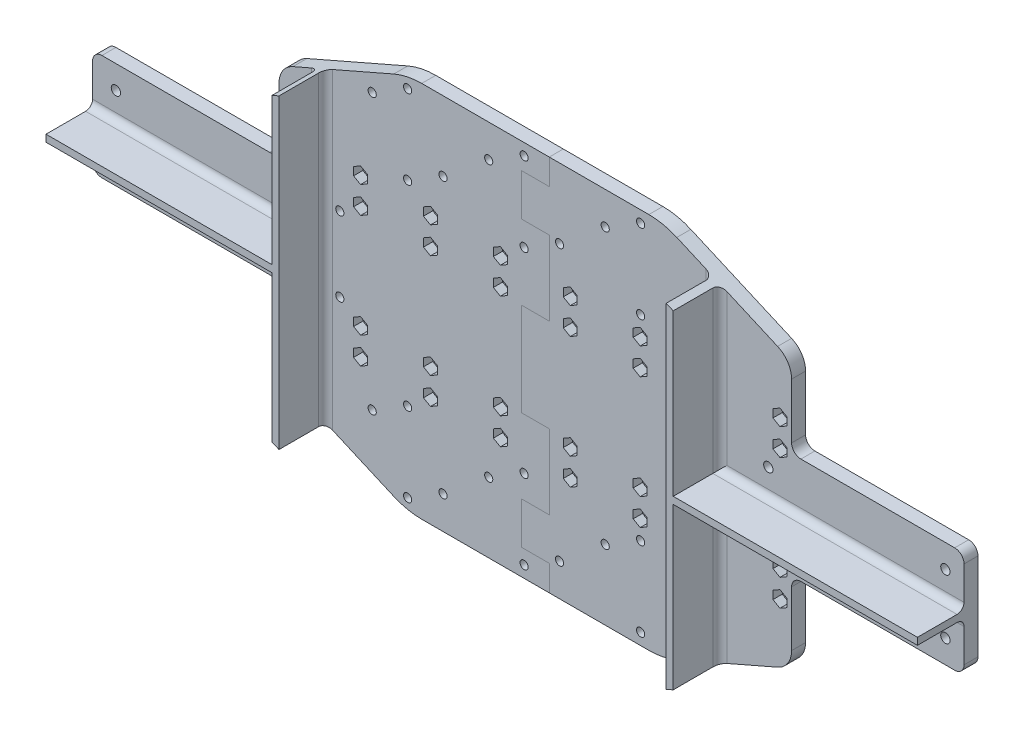
from build123d import *

# Parameters (mm, degrees)
BOSS_EXTRUDE1_DEPTH     = 3
BOSS_EXTRUDE2_DEPTH     = 20
SKETCH4_R               = 1.75
CUT_EXTRUDE1_DEPTH      = 205.768161588
FILLET1_R               = 4
FILLET2_R               = 3
CUT_EXTRUDE2_REACH      = 207.441
SKETCH5_R               = 2
SKETCH6_R               = 1.75
CUT_EXTRUDE3_DEPTH      = 205.768161588
SKETCH8_R               = 1.75
CUT_EXTRUDE5_DEPTH      = 205.768161588
SKETCH9_R               = 1.75
CUT_EXTRUDE6_DEPTH      = 205.768161588
CUT_EXTRUDE7_DEPTH      = 4
SPLIT1_SURFACE_1_BACK   = 409.407
SPLIT1_SURFACE_1_DEPTH  = 818.814
SPLIT1_SURFACE_2_BACK   = 409.407
SPLIT1_SURFACE_2_DEPTH  = 818.814
CUT_EXTRUDE8_DEPTH      = 206.082910063
CUT_EXTRUDE8_DEPTH_BACK = 206.082910063
FILLET3_R               = 4
FILLET4_R               = 4
FILLET5_R               = 10
FILLET6_R               = 10
FILLET7_R               = 30
FILLET8_R               = 30


with BuildPart() as part:
    # Sketch2 → Boss-Extrude1 (new, symmetric)
    with BuildSketch(Plane.XY):
        Polygon((-187, 22.75), (-187, -22.75), (-107, -22.75), (-107, -81), (113, -81), (113, -22.75), (187, -22.75), (187, 22.75), (113, 22.75), (113, 81), (-107, 81), (-107, 22.75), align=None)
    extrude(amount=BOSS_EXTRUDE1_DEPTH, both=True)

    # Sketch3 → Boss-Extrude2 (add)
    with BuildSketch(Plane.XY.offset(3)):
        Polygon((-187, -1.5), (-90, -1.5), (-90, -81), (-87, -81), (-87, 81), (-90, 81), (-90, 1.5), (-187, 1.5), align=None)
        Polygon((82.2, -81), (82.2, -1.5), (187, -1.5), (187, 1.5), (82.2, 1.5), (82.2, 81), (79.2, 81), (79.2, -81), align=None)
    extrude(amount=BOSS_EXTRUDE2_DEPTH)

    # Sketch4 → Cut-Extrude1 (cut, through all)
    with BuildSketch(Plane.XY.offset(3)):
        with Locations((-36.6, -67)):
            Circle(SKETCH4_R)
        with Locations((-67, -51)):
            Circle(SKETCH4_R)
        with Locations((13.4, -67)):
            Circle(SKETCH4_R)
        with Locations((-17, -51)):
            Circle(SKETCH4_R)
        with Locations((63.4, -67)):
            Circle(SKETCH4_R)
        with Locations((33, -51)):
            Circle(SKETCH4_R)
        with Locations((33, 67)):
            Circle(SKETCH4_R)
        with Locations((63.4, 51)):
            Circle(SKETCH4_R)
        with Locations((13.4, 51)):
            Circle(SKETCH4_R)
        with Locations((-17, 67)):
            Circle(SKETCH4_R)
        with Locations((-36.6, 51)):
            Circle(SKETCH4_R)
        with Locations((-67, 67)):
            Circle(SKETCH4_R)
    extrude(amount=-CUT_EXTRUDE1_DEPTH, mode=Mode.SUBTRACT)

    # Fillet1
    fillet1_edges = [part.edges().sort_by_distance(p)[0] for p in [
        (-107, 22.75, 0),
        (-107, -22.75, 0),
        (113, -22.75, 0),
        (113, 22.75, 0),
    ]]
    fillet(fillet1_edges, radius=FILLET1_R)

    # Fillet2
    fillet2_edges = [part.edges().sort_by_distance(p)[0] for p in [
        (-90, 41.25, 3),
        (-138.5, 1.5, 3),
        (-138.5, -1.5, 3),
        (-90, -41.25, 3),
        (82.2, -41.25, 3),
        (134.6, -1.5, 3),
        (134.6, 1.5, 3),
        (82.2, 41.25, 3),
        (-87, 0, 3),
        (79.2, 0, 3),
    ]]
    fillet(fillet2_edges, radius=FILLET2_R)

    # Sketch5 → Cut-Extrude2 (cut, up to next)
    with BuildSketch(Plane(origin=(0, 0, -3), x_dir=(-1, 0, 0), z_dir=(0, 0, -1)), mode=Mode.PRIVATE) as cut_extrude2_sk1:
        with Locations((-103, -12.75)):
            Circle(SKETCH5_R)
    cut_extrude2_tool1 = extrude(cut_extrude2_sk1.sketch, amount=-CUT_EXTRUDE2_REACH, mode=Mode.PRIVATE) & part.part
    # Sketch5 → Cut-Extrude2 (cut, up to next)
    with BuildSketch(Plane(origin=(0, 0, -3), x_dir=(-1, 0, 0), z_dir=(0, 0, -1)), mode=Mode.PRIVATE) as cut_extrude2_sk2:
        with Locations((-103, 12.75)):
            Circle(SKETCH5_R)
    cut_extrude2_tool2 = extrude(cut_extrude2_sk2.sketch, amount=-CUT_EXTRUDE2_REACH, mode=Mode.PRIVATE) & part.part
    # Sketch5 → Cut-Extrude2 (cut, up to next)
    with BuildSketch(Plane(origin=(0, 0, -3), x_dir=(-1, 0, 0), z_dir=(0, 0, -1)), mode=Mode.PRIVATE) as cut_extrude2_sk3:
        with Locations((-179, 12.75)):
            Circle(SKETCH5_R)
    cut_extrude2_tool3 = extrude(cut_extrude2_sk3.sketch, amount=-CUT_EXTRUDE2_REACH, mode=Mode.PRIVATE) & part.part
    # Sketch5 → Cut-Extrude2 (cut, up to next)
    with BuildSketch(Plane(origin=(0, 0, -3), x_dir=(-1, 0, 0), z_dir=(0, 0, -1)), mode=Mode.PRIVATE) as cut_extrude2_sk4:
        with Locations((-179, -12.75)):
            Circle(SKETCH5_R)
    cut_extrude2_tool4 = extrude(cut_extrude2_sk4.sketch, amount=-CUT_EXTRUDE2_REACH, mode=Mode.PRIVATE) & part.part
    # Sketch5 → Cut-Extrude2 (cut, up to next)
    with BuildSketch(Plane(origin=(0, 0, -3), x_dir=(-1, 0, 0), z_dir=(0, 0, -1)), mode=Mode.PRIVATE) as cut_extrude2_sk5:
        with Locations((177, 12.75)):
            Circle(SKETCH5_R)
    cut_extrude2_tool5 = extrude(cut_extrude2_sk5.sketch, amount=-CUT_EXTRUDE2_REACH, mode=Mode.PRIVATE) & part.part
    # Sketch5 → Cut-Extrude2 (cut, up to next)
    with BuildSketch(Plane(origin=(0, 0, -3), x_dir=(-1, 0, 0), z_dir=(0, 0, -1)), mode=Mode.PRIVATE) as cut_extrude2_sk6:
        with Locations((177, -12.75)):
            Circle(SKETCH5_R)
    cut_extrude2_tool6 = extrude(cut_extrude2_sk6.sketch, amount=-CUT_EXTRUDE2_REACH, mode=Mode.PRIVATE) & part.part
    # Sketch5 → Cut-Extrude2 (cut, up to next)
    with BuildSketch(Plane(origin=(0, 0, -3), x_dir=(-1, 0, 0), z_dir=(0, 0, -1)), mode=Mode.PRIVATE) as cut_extrude2_sk7:
        with Locations((101, -12.75)):
            Circle(SKETCH5_R)
    cut_extrude2_tool7 = extrude(cut_extrude2_sk7.sketch, amount=-CUT_EXTRUDE2_REACH, mode=Mode.PRIVATE) & part.part
    # Sketch5 → Cut-Extrude2 (cut, up to next)
    with BuildSketch(Plane(origin=(0, 0, -3), x_dir=(-1, 0, 0), z_dir=(0, 0, -1)), mode=Mode.PRIVATE) as cut_extrude2_sk8:
        with Locations((101, 12.75)):
            Circle(SKETCH5_R)
    cut_extrude2_tool8 = extrude(cut_extrude2_sk8.sketch, amount=-CUT_EXTRUDE2_REACH, mode=Mode.PRIVATE) & part.part
    add(cut_extrude2_tool1.solids().sort_by_distance((103, -12.75, -3))[0], mode=Mode.SUBTRACT)
    add(cut_extrude2_tool2.solids().sort_by_distance((103, 12.75, -3))[0], mode=Mode.SUBTRACT)
    add(cut_extrude2_tool3.solids().sort_by_distance((179, 12.75, -3))[0], mode=Mode.SUBTRACT)
    add(cut_extrude2_tool4.solids().sort_by_distance((179, -12.75, -3))[0], mode=Mode.SUBTRACT)
    add(cut_extrude2_tool5.solids().sort_by_distance((-177, 12.75, -3))[0], mode=Mode.SUBTRACT)
    add(cut_extrude2_tool6.solids().sort_by_distance((-177, -12.75, -3))[0], mode=Mode.SUBTRACT)
    add(cut_extrude2_tool7.solids().sort_by_distance((-101, -12.75, -3))[0], mode=Mode.SUBTRACT)
    add(cut_extrude2_tool8.solids().sort_by_distance((-101, 12.75, -3))[0], mode=Mode.SUBTRACT)

    # Sketch6 → Cut-Extrude3 (cut, through all)
    with BuildSketch(Plane.XY.offset(3)):
        with Locations((-51.8, -76)):
            Circle(SKETCH6_R)
        with Locations((-51.8, -42)):
            Circle(SKETCH6_R)
        with Locations((-1.8, -76)):
            Circle(SKETCH6_R)
        with Locations((-1.8, -42)):
            Circle(SKETCH6_R)
        with Locations((48.2, -76)):
            Circle(SKETCH6_R)
        with Locations((48.2, -42)):
            Circle(SKETCH6_R)
        with Locations((48.2, 42)):
            Circle(SKETCH6_R)
        with Locations((48.2, 76)):
            Circle(SKETCH6_R)
        with Locations((-1.8, 42)):
            Circle(SKETCH6_R)
        with Locations((-1.8, 76)):
            Circle(SKETCH6_R)
        with Locations((-51.8, 42)):
            Circle(SKETCH6_R)
        with Locations((-51.8, 76)):
            Circle(SKETCH6_R)
    extrude(amount=-CUT_EXTRUDE3_DEPTH, mode=Mode.SUBTRACT)

    # Sketch8 → Cut-Extrude5 (cut, through all)
    with BuildSketch(Plane.XY.offset(3)):
        with Locations((-80.9, -16)):
            Circle(SKETCH8_R)
        with Locations((-80.9, 16)):
            Circle(SKETCH8_R)
        with Locations((73.1, 16)):
            Circle(SKETCH8_R)
        with Locations((73.1, -16)):
            Circle(SKETCH8_R)
    extrude(amount=-CUT_EXTRUDE5_DEPTH, mode=Mode.SUBTRACT)

    # Sketch9 → Cut-Extrude6 (cut, through all)
    with BuildSketch(Plane.XY.offset(3)):
        with Locations((-12, -33.75)):
            Circle(SKETCH9_R)
        with Locations((-42, -33.75)):
            Circle(SKETCH9_R)
        with Locations((-72, -33.75)):
            Circle(SKETCH9_R)
        with Locations((-102, -33.75)):
            Circle(SKETCH9_R)
        with Locations((108, -33.75)):
            Circle(SKETCH9_R)
        with Locations((48, -33.75)):
            Circle(SKETCH9_R)
        with Locations((18, -33.75)):
            Circle(SKETCH9_R)
        with Locations((18, -22.25)):
            Circle(SKETCH9_R)
        with Locations((48, -22.25)):
            Circle(SKETCH9_R)
        with Locations((108, -22.25)):
            Circle(SKETCH9_R)
        with Locations((-102, -22.25)):
            Circle(SKETCH9_R)
        with Locations((-72, -22.25)):
            Circle(SKETCH9_R)
        with Locations((-42, -22.25)):
            Circle(SKETCH9_R)
        with Locations((-12, -22.25)):
            Circle(SKETCH9_R)
        with Locations((-12, 22.25)):
            Circle(SKETCH9_R)
        with Locations((-42, 22.25)):
            Circle(SKETCH9_R)
        with Locations((-72, 22.25)):
            Circle(SKETCH9_R)
        with Locations((-102, 22.25)):
            Circle(SKETCH9_R)
        with Locations((108, 22.25)):
            Circle(SKETCH9_R)
        with Locations((48, 22.25)):
            Circle(SKETCH9_R)
        with Locations((18, 22.25)):
            Circle(SKETCH9_R)
        with Locations((18, 33.75)):
            Circle(SKETCH9_R)
        with Locations((48, 33.75)):
            Circle(SKETCH9_R)
        with Locations((108, 33.75)):
            Circle(SKETCH9_R)
        with Locations((-102, 33.75)):
            Circle(SKETCH9_R)
        with Locations((-72, 33.75)):
            Circle(SKETCH9_R)
        with Locations((-42, 33.75)):
            Circle(SKETCH9_R)
        with Locations((-12, 33.75)):
            Circle(SKETCH9_R)
    extrude(amount=-CUT_EXTRUDE6_DEPTH, mode=Mode.SUBTRACT)

    # Sketch10 → Cut-Extrude7 (cut)
    with BuildSketch(Plane.XY.offset(3)):
        Polygon((-99, -35.482050808), (-99, -32.017949192), (-102, -30.285898385), (-105, -32.017949192), (-105, -35.482050808), (-102, -37.214101615), align=None)
        Polygon((-69, -35.482050808), (-69, -32.017949192), (-72, -30.285898385), (-75, -32.017949192), (-75, -35.482050808), (-72, -37.214101615), align=None)
        Polygon((-39, -35.482050808), (-39, -32.017949192), (-42, -30.285898385), (-45, -32.017949192), (-45, -35.482050808), (-42, -37.214101615), align=None)
        Polygon((-9, -35.482050808), (-9, -32.017949192), (-12, -30.285898385), (-15, -32.017949192), (-15, -35.482050808), (-12, -37.214101615), align=None)
        Polygon((51, -32.017949192), (51, -35.482050808), (48, -37.214101615), (45, -35.482050808), (45, -32.017949192), (48, -30.285898385), align=None)
        Polygon((15, -32.017949192), (18, -30.285898385), (21, -32.017949192), (21, -35.482050808), (18, -37.214101615), (15, -35.482050808), align=None)
        Polygon((51, -23.982050808), (51, -20.517949192), (48, -18.785898385), (45, -20.517949192), (45, -23.982050808), (48, -25.714101615), align=None)
        Polygon((105, -23.982050808), (108, -25.714101615), (111, -23.982050808), (111, -20.517949192), (108, -18.785898385), (105, -20.517949192), align=None)
        Polygon((105, -32.017949192), (108, -30.285898385), (111, -32.017949192), (111, -35.482050808), (108, -37.214101615), (105, -35.482050808), align=None)
        Polygon((-45, -20.517949192), (-42, -18.785898385), (-39, -20.517949192), (-39, -23.982050808), (-42, -25.714101615), (-45, -23.982050808), align=None)
        Polygon((-15, -20.517949192), (-12, -18.785898385), (-9, -20.517949192), (-9, -23.982050808), (-12, -25.714101615), (-15, -23.982050808), align=None)
        Polygon((21, -20.517949192), (18, -18.785898385), (15, -20.517949192), (15, -23.982050808), (18, -25.714101615), (21, -23.982050808), align=None)
        Polygon((-105, -23.982050808), (-105, -20.517949192), (-102, -18.785898385), (-99, -20.517949192), (-99, -23.982050808), (-102, -25.714101615), align=None)
        Polygon((-72, -25.714101615), (-75, -23.982050808), (-75, -20.517949192), (-72, -18.785898385), (-69, -20.517949192), (-69, -23.982050808), align=None)
        Polygon((-69, 20.517949192), (-69, 23.982050808), (-72, 25.714101615), (-75, 23.982050808), (-75, 20.517949192), (-72, 18.785898385), align=None)
        Polygon((-75, 35.482050808), (-72, 37.214101615), (-69, 35.482050808), (-69, 32.017949192), (-72, 30.285898385), (-75, 32.017949192), align=None)
        Polygon((-99, 20.517949192), (-99, 23.982050808), (-102, 25.714101615), (-105, 23.982050808), (-105, 20.517949192), (-102, 18.785898385), align=None)
        Polygon((-105, 35.482050808), (-102, 37.214101615), (-99, 35.482050808), (-99, 32.017949192), (-102, 30.285898385), (-105, 32.017949192), align=None)
        Polygon((-12, 18.785898385), (-9, 20.517949192), (-9, 23.982050808), (-12, 25.714101615), (-15, 23.982050808), (-15, 20.517949192), align=None)
        Polygon((-15, 35.482050808), (-12, 37.214101615), (-9, 35.482050808), (-9, 32.017949192), (-12, 30.285898385), (-15, 32.017949192), align=None)
        Polygon((-39, 20.517949192), (-39, 23.982050808), (-42, 25.714101615), (-45, 23.982050808), (-45, 20.517949192), (-42, 18.785898385), align=None)
        Polygon((-45, 32.017949192), (-45, 35.482050808), (-42, 37.214101615), (-39, 35.482050808), (-39, 32.017949192), (-42, 30.285898385), align=None)
        Polygon((45, 23.982050808), (48, 25.714101615), (51, 23.982050808), (51, 20.517949192), (48, 18.785898385), (45, 20.517949192), align=None)
        Polygon((51, 32.017949192), (51, 35.482050808), (48, 37.214101615), (45, 35.482050808), (45, 32.017949192), (48, 30.285898385), align=None)
        Polygon((15, 23.982050808), (18, 25.714101615), (21, 23.982050808), (21, 20.517949192), (18, 18.785898385), (15, 20.517949192), align=None)
        Polygon((21, 32.017949192), (21, 35.482050808), (18, 37.214101615), (15, 35.482050808), (15, 32.017949192), (18, 30.285898385), align=None)
        Polygon((105, 23.982050808), (108, 25.714101615), (111, 23.982050808), (111, 20.517949192), (108, 18.785898385), (105, 20.517949192), align=None)
        Polygon((111, 32.017949192), (111, 35.482050808), (108, 37.214101615), (105, 35.482050808), (105, 32.017949192), (108, 30.285898385), align=None)
    extrude(amount=-CUT_EXTRUDE7_DEPTH, mode=Mode.SUBTRACT)


with BuildPart() as body_2:
    # Split1: the piece behind the surface
    add(part.part)
    # Split1 surface: a surface, the sketch's curves swept straight by 818.814 mm
    with BuildLine(Plane.XY.offset(3).offset(-SPLIT1_SURFACE_1_BACK), mode=Mode.PRIVATE) as split1_surface_1_path:
        Line((9, -81), (9, -70))
        Line((9, -70), (-3, -70))
        Line((-3, -70), (-3, -52))
        Line((-3, -52), (9, -52))
        Line((9, -52), (9, -20))
        Line((9, -20), (-3, -20))
        Line((-3, -20), (-3, 20))
        Line((-3, 20), (9, 20))
        Line((9, 20), (9, 52))
        Line((9, 52), (-3, 52))
        Line((-3, 52), (-3, 70))
        Line((-3, 70), (9, 70))
        Line((9, 70), (9, 81))
    split1_surface_1 = Shell.extrude(split1_surface_1_path.wire(), (0 * SPLIT1_SURFACE_1_DEPTH, 0 * SPLIT1_SURFACE_1_DEPTH, 1 * SPLIT1_SURFACE_1_DEPTH))
    split(bisect_by=split1_surface_1, keep=Keep.BOTTOM)


with BuildPart() as part_1:
    add(part.part)

    # Split1: split by a surface, the side it looks to stays
    # Split1 surface: a surface, the sketch's curves swept straight by 818.814 mm
    with BuildLine(Plane.XY.offset(3).offset(-SPLIT1_SURFACE_2_BACK), mode=Mode.PRIVATE) as split1_surface_2_path:
        Line((9, -81), (9, -70))
        Line((9, -70), (-3, -70))
        Line((-3, -70), (-3, -52))
        Line((-3, -52), (9, -52))
        Line((9, -52), (9, -20))
        Line((9, -20), (-3, -20))
        Line((-3, -20), (-3, 20))
        Line((-3, 20), (9, 20))
        Line((9, 20), (9, 52))
        Line((9, 52), (-3, 52))
        Line((-3, 52), (-3, 70))
        Line((-3, 70), (9, 70))
        Line((9, 70), (9, 81))
    split1_surface_2 = Shell.extrude(split1_surface_2_path.wire(), (0 * SPLIT1_SURFACE_2_DEPTH, 0 * SPLIT1_SURFACE_2_DEPTH, 1 * SPLIT1_SURFACE_2_DEPTH))
    split(bisect_by=split1_surface_2, keep=Keep.TOP)


with BuildPart() as cut_extrude8_tool:
    # Sketch12 → Cut-Extrude8 (new, two sides: drawn at the far end of the back side and taken through both)
    with BuildSketch(Plane.XY.offset(-CUT_EXTRUDE8_DEPTH_BACK)):
        Polygon((-107, -57), (-52, -81), (-107, -81), align=None)
        Polygon((113, -57), (58, -81), (113, -81), align=None)
        Polygon((113, 81), (113, 57), (58, 81), align=None)
        Polygon((-107, 81), (-107, 57), (-52, 81), align=None)
    extrude(amount=CUT_EXTRUDE8_DEPTH + CUT_EXTRUDE8_DEPTH_BACK)


with BuildPart() as part_2:
    add(part_1.part)

    # Cut-Extrude8: cut by cut_extrude8_tool
    add(cut_extrude8_tool.part, mode=Mode.SUBTRACT)

    # Fillet4
    fillet4_edges = [part_2.edges().sort_by_distance(p)[0] for p in [
        (-187, 22.75, 0),
        (-187, -22.75, 0),
    ]]
    fillet(fillet4_edges, radius=FILLET4_R)

    # Fillet6
    fillet6_edges = [part_2.edges().sort_by_distance(p)[0] for p in [
        (-107, 57, 0),
        (-107, -57, 0),
    ]]
    fillet(fillet6_edges, radius=FILLET6_R)

    # Fillet8
    fillet8_edges = [part_2.edges().sort_by_distance(p)[0] for p in [
        (-52, -81, 0),
        (-52, 81, 0),
    ]]
    fillet(fillet8_edges, radius=FILLET8_R)


with BuildPart() as body_2_1:
    add(body_2.part)

    # Cut-Extrude8: cut by cut_extrude8_tool
    add(cut_extrude8_tool.part, mode=Mode.SUBTRACT)

    # Fillet3
    fillet3_edges = [body_2_1.edges().sort_by_distance(p)[0] for p in [
        (187, 22.75, 0),
        (187, -22.75, 0),
    ]]
    fillet(fillet3_edges, radius=FILLET3_R)

    # Fillet5
    fillet5_edges = [body_2_1.edges().sort_by_distance(p)[0] for p in [
        (113, 57, 0),
        (113, -57, 0),
    ]]
    fillet(fillet5_edges, radius=FILLET5_R)

    # Fillet7
    fillet7_edges = [body_2_1.edges().sort_by_distance(p)[0] for p in [
        (58, 81, 0),
        (58, -81, 0),
    ]]
    fillet(fillet7_edges, radius=FILLET7_R)


solid = Compound([part_2.part, body_2_1.part])
